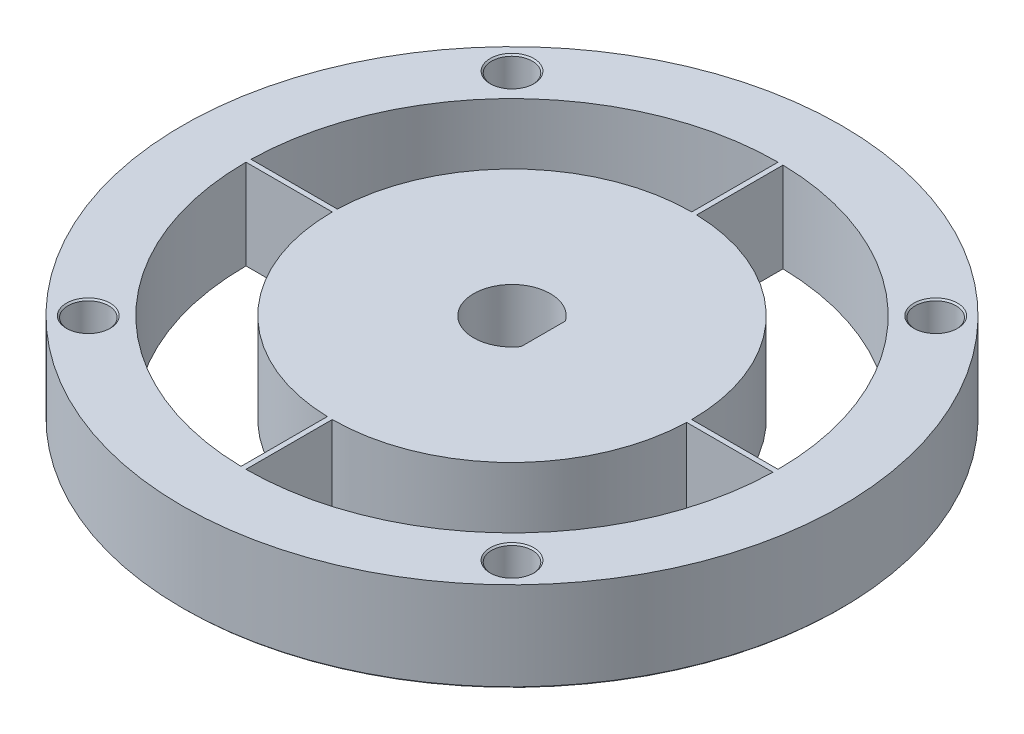
from build123d import *

# Parameters (mm, degrees)
SKETCH2_R             = 27.5
SKETCH2_R_2           = 22.197520882
BOSS_EXTRUDE3_DEPTH   = 7.5
BOSS_EXTRUDE3_2_DEPTH = 7.5
SKETCH5_R             = 1.7
SKETCH5_W             = 0.42
SKETCH5_H             = 13.5
SKETCH5_W_2           = 13.5
SKETCH5_H_2           = 0.42
CUT_EXTRUDE6_DEPTH    = 40.607448794
CUT_EXTRUDE8_DEPTH    = 7.5
CHAMFER3_SIZE         = 0.125
CHAMFER4_SIZE         = 0.125
SKETCH14_W            = 0.42
SKETCH14_H            = 13.5
SKETCH14_W_2          = 13.5
SKETCH14_H_2          = 0.42
BOSS_EXTRUDE5_DEPTH   = 7.5


with BuildPart() as part:
    # Sketch2 → Boss-Extrude3 (new body)
    with BuildSketch(Plane(origin=(0, 0, 0), x_dir=(1, 0, 0), z_dir=(0, 1, 0))):
        Circle(SKETCH2_R)
        Circle(SKETCH2_R_2, mode=Mode.SUBTRACT)
    extrude(amount=BOSS_EXTRUDE3_DEPTH)

    # Sketch5 → Cut-Extrude6 (cut, through all)
    with BuildSketch(Plane.XZ):
        with Locations((-17.67766953, 17.67766953)):
            Circle(SKETCH5_R)
        with Locations((17.67766953, 17.67766953)):
            Circle(SKETCH5_R)
        with Locations((17.67766953, -17.67766953)):
            Circle(SKETCH5_R)
        with Locations((-17.67766953, -17.67766953)):
            Circle(SKETCH5_R)
        with Locations((0.21, -18.733167206)):
            Rectangle(SKETCH5_W, SKETCH5_H)
        with Locations((-18.733167206, -0.21)):
            Rectangle(SKETCH5_W_2, SKETCH5_H_2)
        with Locations((-0.21, 18.733167206)):
            Rectangle(SKETCH5_W, SKETCH5_H)
        with Locations((18.733167206, 0.21)):
            Rectangle(SKETCH5_W_2, SKETCH5_H_2)
    extrude(amount=-CUT_EXTRUDE6_DEPTH, mode=Mode.SUBTRACT)

    # Chamfer4
    chamfer4_edges = [part.edges().sort_by_distance(p)[0] for p in [
        (-27.5, 0, 0),
        (15.97766953, 0, 17.67766953),
        (15.97766953, 0, -17.67766953),
        (-19.37766953, 0, -17.67766953),
        (-19.37766953, 0, 17.67766953),
        (-19.37766953, 7.5, 17.67766953),
        (15.97766953, 7.5, 17.67766953),
        (15.97766953, 7.5, -17.67766953),
        (-19.37766953, 7.5, -17.67766953),
    ]]
    chamfer(chamfer4_edges, length=CHAMFER4_SIZE)



with BuildPart() as body_2:
    # Sketch2 → Boss-Extrude3 2 (new body)
    with BuildSketch(Plane(origin=(0, 0, 0), x_dir=(1, 0, 0), z_dir=(0, 1, 0))):
        with BuildLine():
            Line((0, -15), (0, -11.983167206))
            Line((0, -11.983167206), (-0.42, -11.983167206))
            Line((-0.42, -11.983167206), (-0.42, -14.994118847))
            ThreePointArc((-0.42, -14.994118847), (-10.754068997, -10.457055035), (-15, 0))
            Line((-15, 0), (-11.983167206, 0))
            Line((-11.983167206, 0), (-11.983167206, 0.42))
            Line((-11.983167206, 0.42), (-14.994118847, 0.42))
            ThreePointArc((-14.994118847, 0.42), (-10.457055035, 10.754068997), (0, 15))
            Line((0, 15), (0, 11.983167206))
            Line((0, 11.983167206), (0.42, 11.983167206))
            Line((0.42, 11.983167206), (0.42, 14.994118847))
            ThreePointArc((0.42, 14.994118847), (10.754068997, 10.457055035), (15, 0))
            Line((15, 0), (11.983167206, 0))
            Line((11.983167206, 0), (11.983167206, -0.42))
            Line((11.983167206, -0.42), (14.994118847, -0.42))
            ThreePointArc((14.994118847, -0.42), (10.457055035, -10.754068997), (0, -15))
        make_face()
    extrude(amount=BOSS_EXTRUDE3_2_DEPTH)

    # Sketch7 → Cut-Extrude8 (cut)
    with BuildSketch(Plane.XZ):
        with BuildLine():
            Line((2.611025673, 1.850012144), (2.611025673, -1.850012144))
            ThreePointArc((2.611025673, -1.850012144), (-3.2, 0), (2.611025673, 1.850012144))
        make_face()
    extrude(amount=-CUT_EXTRUDE8_DEPTH, mode=Mode.SUBTRACT)

    # Chamfer3
    chamfer3_edges = [body_2.edges().sort_by_distance(p)[0] for p in [
        (2.611025673, 0, 0),
        (-3.2, 0, 0),
    ]]
    chamfer(chamfer3_edges, length=CHAMFER3_SIZE)


with BuildPart() as part_1:
    add(part.part)

    add(body_2.part)  # Boss-Extrude5 merges body 2
    # Sketch14 → Boss-Extrude5 (add)
    with BuildSketch(Plane.XZ):
        with Locations((-0.21, 18.733167206)):
            Rectangle(SKETCH14_W, SKETCH14_H)
        with Locations((18.733167206, 0.21)):
            Rectangle(SKETCH14_W_2, SKETCH14_H_2)
        with Locations((0.21, -18.733167206)):
            Rectangle(SKETCH14_W, SKETCH14_H)
        with Locations((-18.733167206, -0.21)):
            Rectangle(SKETCH14_W_2, SKETCH14_H_2)
    extrude(amount=-BOSS_EXTRUDE5_DEPTH)


solid = part_1.part
